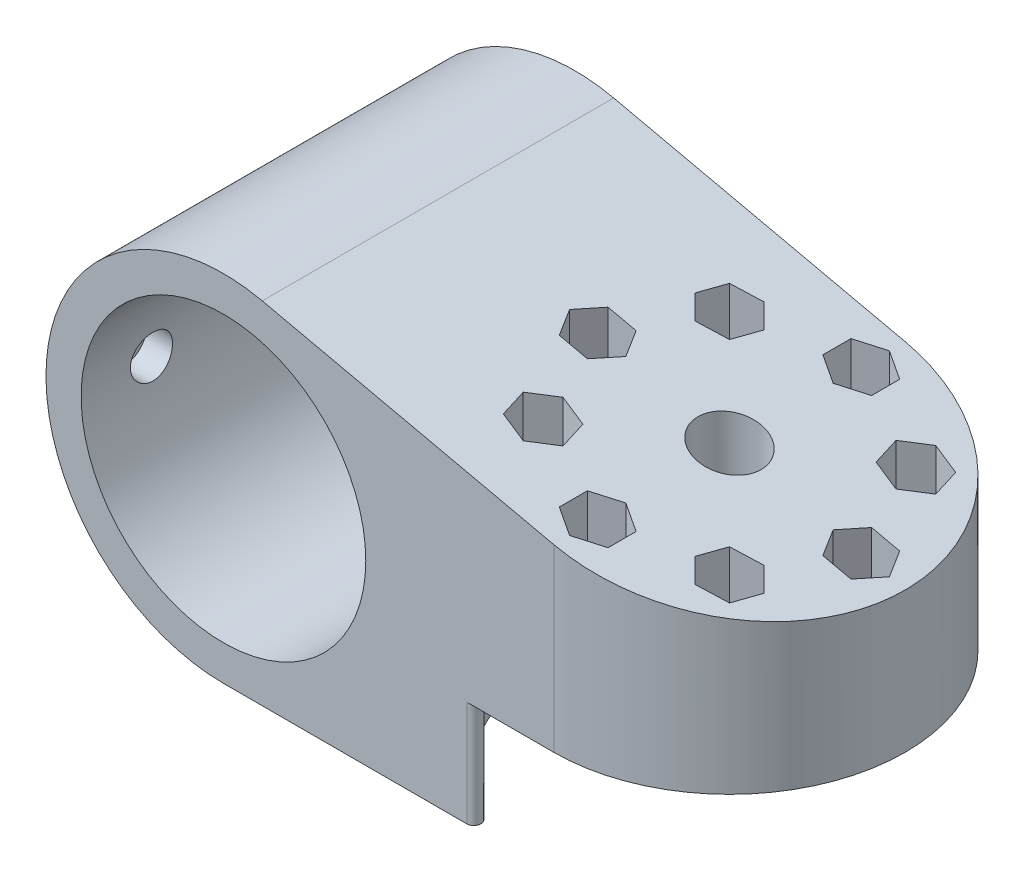
from build123d import *
from build123d.topology import SkipClean

# Parameters (mm, degrees)
SKETCH_1_R                      = 12.5
EXTRUDE_1_DEPTH                 = 10
SKETCH_2_R                      = 4.5
EXTRUDE_2_DEPTH                 = 10
EXTRUDE_4_DEPTH                 = 25
EXTRUDE_4_DEPTH_BACK            = 25
SKETCH_13_R                     = 20.25
SKETCH_8_R                      = 2.5
SKETCH_8_R_2                    = 4.5
CUT_EXTRUDE_2_DEPTH             = 85.292985729
CUT_EXTRUDE_6_DEPTH             = 13.5
CUT_EXTRUDE_6_DIRECTION_2_REACH = 85.47
CUT_EXTRUDE_8_DEPTH             = 85.292985729
SKETCH_16_R                     = 2
CUT_EXTRUDE_9_DEPTH             = 43
SKETCH_17_R                     = 3
CUT_EXTRUDE_10_DEPTH            = 4
SKETCH_18_R                     = 26
CUT_EXTRUDE_11_DEPTH            = 15
EXTRUDE_5_DEPTH                 = 15
FILLET_1_R                      = 1


with BuildPart() as part:
    # 草图1 → 凸台-拉伸1 (new body)
    with BuildSketch(Plane(origin=(0, 0, 0), x_dir=(1, 0, 0), z_dir=(0, 1, 0))):
        with BuildLine():
            Line((0, 25), (-25, 25))
            Line((-25, 25), (-25, 0))
            Line((-25, 0), (-25, -25))
            Line((-25, -25), (0, -25))
            ThreePointArc((0, -25), (25, 0), (0, 25))
        make_face()
        with Locations(Location((0, 0, 0), (0, 0, 270))):
            Circle(SKETCH_1_R, mode=Mode.SUBTRACT)
    extrude(amount=EXTRUDE_1_DEPTH)

    # 草图2 → 凸台-拉伸2 (add)
    with BuildSketch(Plane(origin=(0, 10, 0), x_dir=(1, 0, 0), z_dir=(0, 1, 0))):
        with BuildLine():
            Line((0, 25), (-25, 25))
            Line((-25, 25), (-25, 0))
            Line((-25, 0), (-25, -25))
            Line((-25, -25), (0, -25))
            ThreePointArc((0, -25), (25, 0), (0, 25))
        make_face()
        with Locations(Location((0, 0, 0), (0, 0, 270))):
            Circle(SKETCH_2_R, mode=Mode.SUBTRACT)
    extrude(amount=EXTRUDE_2_DEPTH)

    # 草图13 → 凸台-拉伸4 (add, two sides: drawn at the far end of the back side and taken through both)
    with BuildSketch(Plane.XY.offset(-EXTRUDE_4_DEPTH_BACK)):
        with BuildLine():
            Line((-25, 20), (25, 20))
            Line((25, 20), (-41.48160186, 34.889526622))
            ThreePointArc((-41.48160186, 34.889526622), (-56.232086603, 33.751653755), (-67.813248889, 24.545773302))
            ThreePointArc((-67.813248889, 24.545773302), (-69.358217625, -1.483468201), (-47.059973081, -15))
            Line((-47.059973081, -15), (-25, -15))
            Line((-25, -15), (-25, 0))
            Line((-25, 0), (-25, 20))
        make_face()
        with Locations((-47, 10.249928777)):
            Circle(SKETCH_13_R, mode=Mode.SUBTRACT)
    extrude(amount=EXTRUDE_4_DEPTH + EXTRUDE_4_DEPTH_BACK)

    # 草图8 → 切除-拉伸2 (cut, through all)
    with BuildSketch(Plane.XZ):
        with Locations(Location((18.75, 0, 0), (0, 0, 270))):
            Circle(SKETCH_8_R)
        with Locations(Location((13.258252147, 13.258252147, 0), (0, 0, 270))):
            Circle(SKETCH_8_R)
        with Locations((0, 18.75)):
            Circle(SKETCH_8_R)
        with Locations((-18.75, 0)):
            Circle(SKETCH_8_R)
        with Locations((-13.258252147, 13.258252147)):
            Circle(SKETCH_8_R)
        with Locations((13.258252147, -13.258252147)):
            Circle(SKETCH_8_R)
        with Locations(Location((0, -18.75, 0), (0, 0, 270))):
            Circle(SKETCH_8_R)
        with Locations(Location((-13.258252147, -13.258252147, 0), (0, 0, 270))):
            Circle(SKETCH_8_R)
        Circle(SKETCH_8_R_2)
    extrude(amount=-CUT_EXTRUDE_2_DEPTH, mode=Mode.SUBTRACT)

    # 草图11 → 切除-拉伸6 (cut)
    with BuildSketch(Plane(origin=(0, 18.5, 0), x_dir=(1, 0, 0), z_dir=(0, 1, 0))):
        Polygon((0, -14.75), (-3.464101615, -16.75), (-3.464101615, -20.75), (0, -22.75), (3.464101615, -20.75), (3.464101615, -16.75), align=None)
        Polygon((-14.293528328, -9.394548842), (-10.429825023, -10.429825023), (-9.394548842, -14.293528328), (-12.222975967, -17.121955452), (-16.086679272, -16.086679272), (-17.121955452, -12.222975967), align=None)
        Polygon((10.429825023, -10.429825023), (9.394548842, -14.293528328), (12.222975967, -17.121955452), (16.086679272, -16.086679272), (17.121955452, -12.222975967), (14.293528328, -9.394548842), align=None)
        Polygon((-9.394548842, 14.293528328), (-10.429825023, 10.429825023), (-14.293528328, 9.394548842), (-17.121955452, 12.222975967), (-16.086679272, 16.086679272), (-12.222975967, 17.121955452), align=None)
        Polygon((-16.75, 3.464101615), (-14.75, 0), (-16.75, -3.464101615), (-20.75, -3.464101615), (-22.75, 0), (-20.75, 3.464101615), align=None)
        Polygon((10.429825023, 10.429825023), (14.293528328, 9.394548842), (17.121955452, 12.222975967), (16.086679272, 16.086679272), (12.222975967, 17.121955452), (9.394548842, 14.293528328), align=None)
        Polygon((14.75, 0), (16.75, -3.464101615), (20.75, -3.464101615), (22.75, 0), (20.75, 3.464101615), (16.75, 3.464101615), align=None)
        Polygon((3.464101615, 16.75), (0, 14.75), (-3.464101615, 16.75), (-3.464101615, 20.75), (0, 22.75), (3.464101615, 20.75), align=None)
    extrude(amount=-CUT_EXTRUDE_6_DEPTH, mode=Mode.SUBTRACT)

    # 切除-拉伸6 direction 2: up to this plane
    cut_extrude_6_direction_2_end = Plane(origin=(25, 20, -25), z_dir=(0.21855042139595313, 0.9758256572296362, 0))
    # 草图11 → 切除-拉伸6 direction 2 (cut, up to the surface)
    with BuildSketch(Plane(origin=(0, 18.5, 0), x_dir=(1, 0, 0), z_dir=(0, 1, 0)), mode=Mode.PRIVATE) as cut_extrude_6_direction_2_sk1:
        Polygon((0, -14.75), (-3.464101615, -16.75), (-3.464101615, -20.75), (0, -22.75), (3.464101615, -20.75), (3.464101615, -16.75), align=None)
    cut_extrude_6_direction_2_tool1 = split(extrude(cut_extrude_6_direction_2_sk1.sketch, amount=CUT_EXTRUDE_6_DIRECTION_2_REACH, mode=Mode.PRIVATE), bisect_by=cut_extrude_6_direction_2_end, keep=Keep.BOTH, mode=Mode.PRIVATE)
    add(cut_extrude_6_direction_2_tool1.solids().sort_by_distance((0, 18.5, 18.75))[0], mode=Mode.SUBTRACT)
    # 草图11 → 切除-拉伸6 direction 2 (cut, up to the surface)
    with BuildSketch(Plane(origin=(0, 18.5, 0), x_dir=(1, 0, 0), z_dir=(0, 1, 0)), mode=Mode.PRIVATE) as cut_extrude_6_direction_2_sk2:
        Polygon((-14.293528328, -9.394548842), (-10.429825023, -10.429825023), (-9.394548842, -14.293528328), (-12.222975967, -17.121955452), (-16.086679272, -16.086679272), (-17.121955452, -12.222975967), align=None)
    cut_extrude_6_direction_2_tool2 = split(extrude(cut_extrude_6_direction_2_sk2.sketch, amount=CUT_EXTRUDE_6_DIRECTION_2_REACH, mode=Mode.PRIVATE), bisect_by=cut_extrude_6_direction_2_end, keep=Keep.BOTH, mode=Mode.PRIVATE)
    add(cut_extrude_6_direction_2_tool2.solids().sort_by_distance((-13.258252, 18.5, 13.258252))[0], mode=Mode.SUBTRACT)
    # 草图11 → 切除-拉伸6 direction 2 (cut, up to the surface)
    with BuildSketch(Plane(origin=(0, 18.5, 0), x_dir=(1, 0, 0), z_dir=(0, 1, 0)), mode=Mode.PRIVATE) as cut_extrude_6_direction_2_sk3:
        Polygon((10.429825023, -10.429825023), (9.394548842, -14.293528328), (12.222975967, -17.121955452), (16.086679272, -16.086679272), (17.121955452, -12.222975967), (14.293528328, -9.394548842), align=None)
    cut_extrude_6_direction_2_tool3 = split(extrude(cut_extrude_6_direction_2_sk3.sketch, amount=CUT_EXTRUDE_6_DIRECTION_2_REACH, mode=Mode.PRIVATE), bisect_by=cut_extrude_6_direction_2_end, keep=Keep.BOTH, mode=Mode.PRIVATE)
    add(cut_extrude_6_direction_2_tool3.solids().sort_by_distance((13.258252, 18.5, 13.258252))[0], mode=Mode.SUBTRACT)
    # 草图11 → 切除-拉伸6 direction 2 (cut, up to the surface)
    with BuildSketch(Plane(origin=(0, 18.5, 0), x_dir=(1, 0, 0), z_dir=(0, 1, 0)), mode=Mode.PRIVATE) as cut_extrude_6_direction_2_sk4:
        Polygon((-9.394548842, 14.293528328), (-10.429825023, 10.429825023), (-14.293528328, 9.394548842), (-17.121955452, 12.222975967), (-16.086679272, 16.086679272), (-12.222975967, 17.121955452), align=None)
    cut_extrude_6_direction_2_tool4 = split(extrude(cut_extrude_6_direction_2_sk4.sketch, amount=CUT_EXTRUDE_6_DIRECTION_2_REACH, mode=Mode.PRIVATE), bisect_by=cut_extrude_6_direction_2_end, keep=Keep.BOTH, mode=Mode.PRIVATE)
    add(cut_extrude_6_direction_2_tool4.solids().sort_by_distance((-13.258252, 18.5, -13.258252))[0], mode=Mode.SUBTRACT)
    # 草图11 → 切除-拉伸6 direction 2 (cut, up to the surface)
    with BuildSketch(Plane(origin=(0, 18.5, 0), x_dir=(1, 0, 0), z_dir=(0, 1, 0)), mode=Mode.PRIVATE) as cut_extrude_6_direction_2_sk5:
        Polygon((-16.75, 3.464101615), (-14.75, 0), (-16.75, -3.464101615), (-20.75, -3.464101615), (-22.75, 0), (-20.75, 3.464101615), align=None)
    cut_extrude_6_direction_2_tool5 = split(extrude(cut_extrude_6_direction_2_sk5.sketch, amount=CUT_EXTRUDE_6_DIRECTION_2_REACH, mode=Mode.PRIVATE), bisect_by=cut_extrude_6_direction_2_end, keep=Keep.BOTH, mode=Mode.PRIVATE)
    add(cut_extrude_6_direction_2_tool5.solids().sort_by_distance((-18.75, 18.5, 0))[0], mode=Mode.SUBTRACT)
    # 草图11 → 切除-拉伸6 direction 2 (cut, up to the surface)
    with BuildSketch(Plane(origin=(0, 18.5, 0), x_dir=(1, 0, 0), z_dir=(0, 1, 0)), mode=Mode.PRIVATE) as cut_extrude_6_direction_2_sk6:
        Polygon((10.429825023, 10.429825023), (14.293528328, 9.394548842), (17.121955452, 12.222975967), (16.086679272, 16.086679272), (12.222975967, 17.121955452), (9.394548842, 14.293528328), align=None)
    cut_extrude_6_direction_2_tool6 = split(extrude(cut_extrude_6_direction_2_sk6.sketch, amount=CUT_EXTRUDE_6_DIRECTION_2_REACH, mode=Mode.PRIVATE), bisect_by=cut_extrude_6_direction_2_end, keep=Keep.BOTH, mode=Mode.PRIVATE)
    add(cut_extrude_6_direction_2_tool6.solids().sort_by_distance((13.258252, 18.5, -13.258252))[0], mode=Mode.SUBTRACT)
    # 草图11 → 切除-拉伸6 direction 2 (cut, up to the surface)
    with BuildSketch(Plane(origin=(0, 18.5, 0), x_dir=(1, 0, 0), z_dir=(0, 1, 0)), mode=Mode.PRIVATE) as cut_extrude_6_direction_2_sk7:
        Polygon((14.75, 0), (16.75, -3.464101615), (20.75, -3.464101615), (22.75, 0), (20.75, 3.464101615), (16.75, 3.464101615), align=None)
    cut_extrude_6_direction_2_tool7 = split(extrude(cut_extrude_6_direction_2_sk7.sketch, amount=CUT_EXTRUDE_6_DIRECTION_2_REACH, mode=Mode.PRIVATE), bisect_by=cut_extrude_6_direction_2_end, keep=Keep.BOTH, mode=Mode.PRIVATE)
    add(cut_extrude_6_direction_2_tool7.solids().sort_by_distance((18.75, 18.5, 0))[0], mode=Mode.SUBTRACT)
    # 草图11 → 切除-拉伸6 direction 2 (cut, up to the surface)
    with BuildSketch(Plane(origin=(0, 18.5, 0), x_dir=(1, 0, 0), z_dir=(0, 1, 0)), mode=Mode.PRIVATE) as cut_extrude_6_direction_2_sk8:
        Polygon((3.464101615, 16.75), (0, 14.75), (-3.464101615, 16.75), (-3.464101615, 20.75), (0, 22.75), (3.464101615, 20.75), align=None)
    cut_extrude_6_direction_2_tool8 = split(extrude(cut_extrude_6_direction_2_sk8.sketch, amount=CUT_EXTRUDE_6_DIRECTION_2_REACH, mode=Mode.PRIVATE), bisect_by=cut_extrude_6_direction_2_end, keep=Keep.BOTH, mode=Mode.PRIVATE)
    add(cut_extrude_6_direction_2_tool8.solids().sort_by_distance((0, 18.5, -18.75))[0], mode=Mode.SUBTRACT)

    # 草图14 → 切除-拉伸8 (cut, through all)
    with BuildSketch(Plane.XZ):
        with BuildLine():
            Line((25, 25), (0, 25))
            ThreePointArc((0, 25), (17.67766953, 17.67766953), (25, 0))
            Line((25, 0), (25, 25))
        make_face()
        with BuildLine():
            Line((25, -25), (25, 0))
            ThreePointArc((25, 0), (17.67766953, -17.67766953), (0, -25))
            Line((0, -25), (25, -25))
        make_face()
    extrude(amount=-CUT_EXTRUDE_8_DEPTH, mode=Mode.SUBTRACT)

    # 草图16 → 切除-拉伸9 (cut)
    with BuildSketch(Plane(origin=(-50, 0, 0), x_dir=(0, 0, -1), z_dir=(1, 0, 0))):
        with Locations((-15, 10.249928777)):
            Circle(SKETCH_16_R)
        with Locations((15, 10.249928777)):
            Circle(SKETCH_16_R)
    extrude(amount=-CUT_EXTRUDE_9_DEPTH, mode=Mode.SUBTRACT)

    # 草图17 → 切除-拉伸10 (cut)
    with BuildSketch(Plane(origin=(-67, 0, 0), x_dir=(0, 0, -1), z_dir=(1, 0, 0))):
        with Locations((-15, 10.249928777)):
            Circle(SKETCH_17_R)
        with Locations((15, 10.249928777)):
            Circle(SKETCH_17_R)
    extrude(amount=-CUT_EXTRUDE_10_DEPTH, mode=Mode.SUBTRACT)

    # 草图18 → 切除-拉伸11 (cut)
    with BuildSketch(Plane.XZ):
        Circle(SKETCH_18_R)
    extrude(amount=CUT_EXTRUDE_11_DEPTH, mode=Mode.SUBTRACT)

    # 草图19 → 凸台-拉伸5 (add)
    with SkipClean():  # the faces are left unmerged after this step: merging them gives an invalid solid
        with BuildSketch(Plane.XZ):
            with BuildLine():
                Line((-7.141428429, 25), (-25, 25))
                Line((-25, 25), (-25, 7.141428429))
                ThreePointArc((-25, 7.141428429), (-18.384776311, 18.384776311), (-7.141428429, 25))
            make_face()
            with BuildLine():
                Line((-25, -7.141428429), (-25, -25))
                Line((-25, -25), (-7.141428429, -25))
                ThreePointArc((-7.141428429, -25), (-18.384776311, -18.384776311), (-25, -7.141428429))
            make_face()
        extrude(amount=EXTRUDE_5_DEPTH)

    # 圆角1
    # the kernel refuses this fillet: 1 mm, written as the material it takes off along each edge
    with BuildSketch(Plane(origin=(-7.141428429, 0, 25), x_dir=(-0.929749456499876, 0, -0.36819281380573593), z_dir=(0, -1, 0))) as fillet_1_piece_1:
        with BuildLine():
            CenterArc((5.228819257, -0.995121502), FILLET_1_R, 95.661837923, 152.733955549)
            Line((4.860626443, -1.924870958), (0, 0))
            ThreePointArc((0, 0), (2.565081145, -0.12684096), (5.13016229, 0))
        make_face()
    extrude(amount=28.069721121, mode=Mode.SUBTRACT)
    with BuildSketch(Plane(origin=(-7.141428429, 0, -25), x_dir=(-1, 0, 0), z_dir=(0, -1, 0))) as fillet_1_piece_2:
        with BuildLine():
            CenterArc((5.227888448, -1), FILLET_1_R, 90, 152.733955549)
            ThreePointArc((4.769765601, -1.888888889), (2.43158473, -0.826514131), (0, 0))
            Line((0, 0), (5.227888448, 0))
        make_face()
    extrude(amount=28.069721121, mode=Mode.SUBTRACT)


solid = part.part
